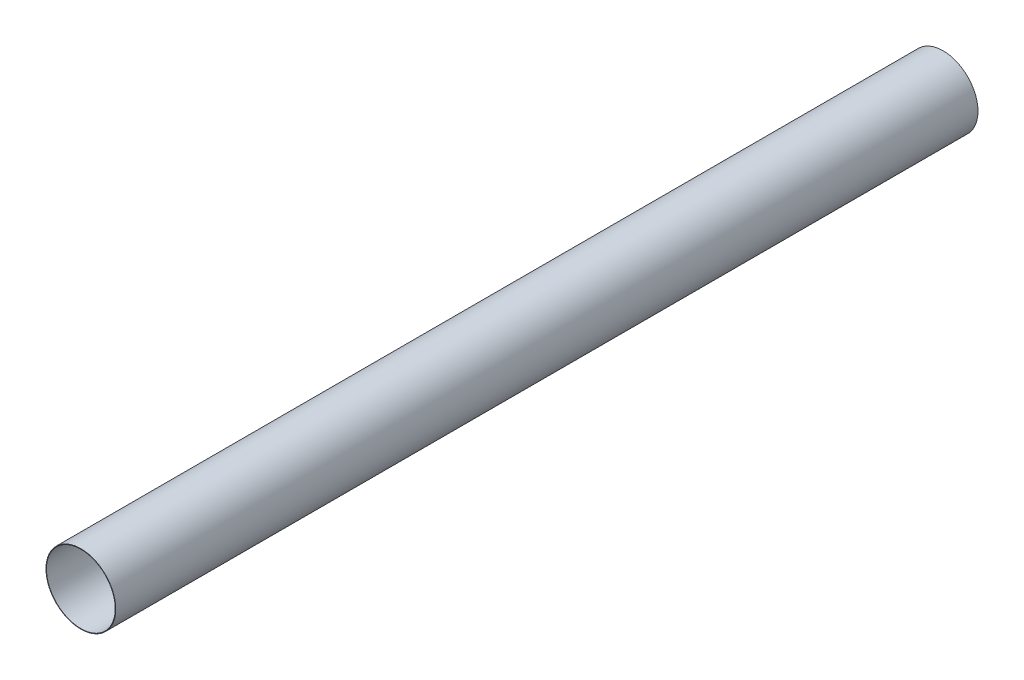
from build123d import *

# Parameters (mm, degrees)
SKETCH1_R           = 73
SKETCH1_R_2         = 72
BOSS_EXTRUDE1_DEPTH = 1804


with BuildPart() as part:
    # Sketch1 → Boss-Extrude1 (new body)
    with BuildSketch(Plane.XY):
        Circle(SKETCH1_R)
        Circle(SKETCH1_R_2, mode=Mode.SUBTRACT)
    extrude(amount=BOSS_EXTRUDE1_DEPTH)


solid = part.part
